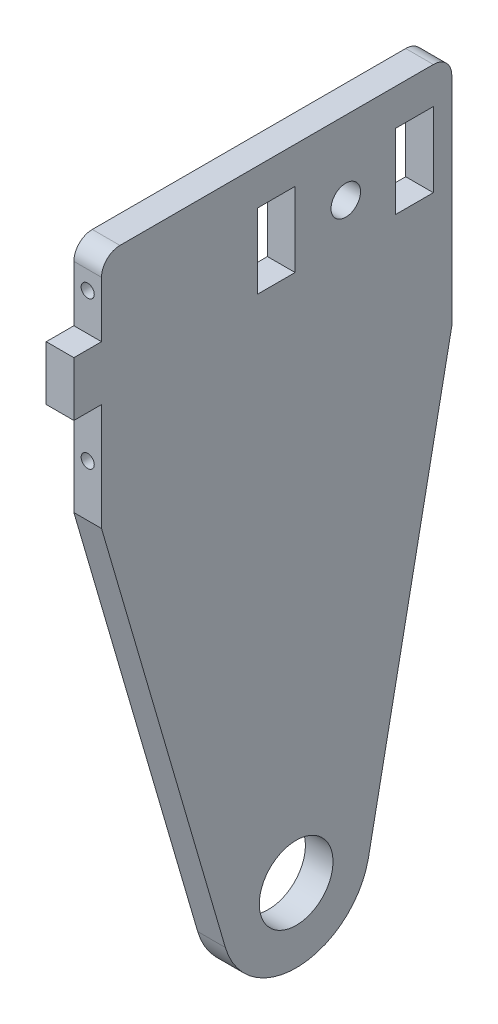
from build123d import *

# Parameters (mm, degrees)
SKETCH1_R           = 6.35
SKETCH1_R_2         = 2.54
SKETCH1_W           = 6.5024
SKETCH1_H           = 12.8524
BOSS_EXTRUDE1_DEPTH = 4.7625
SKETCH2_R           = 1.1303
CUT_EXTRUDE1_DEPTH  = 12.7


with BuildPart() as part:
    # Sketch1 → Boss-Extrude1 (new body)
    with BuildSketch(Plane(origin=(0, 0, 0), x_dir=(0, 0, -1), z_dir=(1, 0, 0))):
        with BuildLine():
            Line((44.45, -27.94), (44.45, 9.514925911))
            ThreePointArc((44.45, 9.514925911), (43.52363892, 11.766499472), (41.275015982, 12.7))
            Line((41.275015982, 12.7), (-12.7, 12.7))
            ThreePointArc((-12.7, 12.7), (-14.94506403, 11.77006403), (-15.875, 9.525))
            Line((-15.875, 9.525), (-15.875, -0.0762))
            Line((-15.875, -0.0762), (-20.6375, -0.0762))
            Line((-20.6375, -0.0762), (-20.6375, -9.4488))
            Line((-20.6375, -9.4488), (-15.875, -9.4488))
            Line((-15.875, -9.4488), (-15.875, -27.94))
            Line((-15.875, -27.94), (5.452914715, -101.107683257))
            ThreePointArc((5.452914715, -101.107683257), (18.198829733, -110.241566871), (30.101167003, -100.032720362))
            Line((30.101167003, -100.032720362), (44.45, -27.94))
        make_face()
        with Locations((17.645481614, -97.553627485)):
            Circle(SKETCH1_R, mode=Mode.SUBTRACT)
        with Locations((26.19375, 0)):
            Circle(SKETCH1_R_2, mode=Mode.SUBTRACT)
        with Locations((38.0238, 0)):
            Rectangle(SKETCH1_W, SKETCH1_H, mode=Mode.SUBTRACT)
        with Locations((14.2113, 0)):
            Rectangle(SKETCH1_W, SKETCH1_H, mode=Mode.SUBTRACT)
    extrude(amount=BOSS_EXTRUDE1_DEPTH)

    # Sketch2 → Cut-Extrude1 (cut)
    with BuildSketch(Plane.XY.offset(15.875)):
        with Locations((2.38125, 6.35)):
            Circle(SKETCH2_R)
        with Locations((2.38125, -19.05)):
            Circle(SKETCH2_R)
    extrude(amount=-CUT_EXTRUDE1_DEPTH, mode=Mode.SUBTRACT)


solid = part.part
